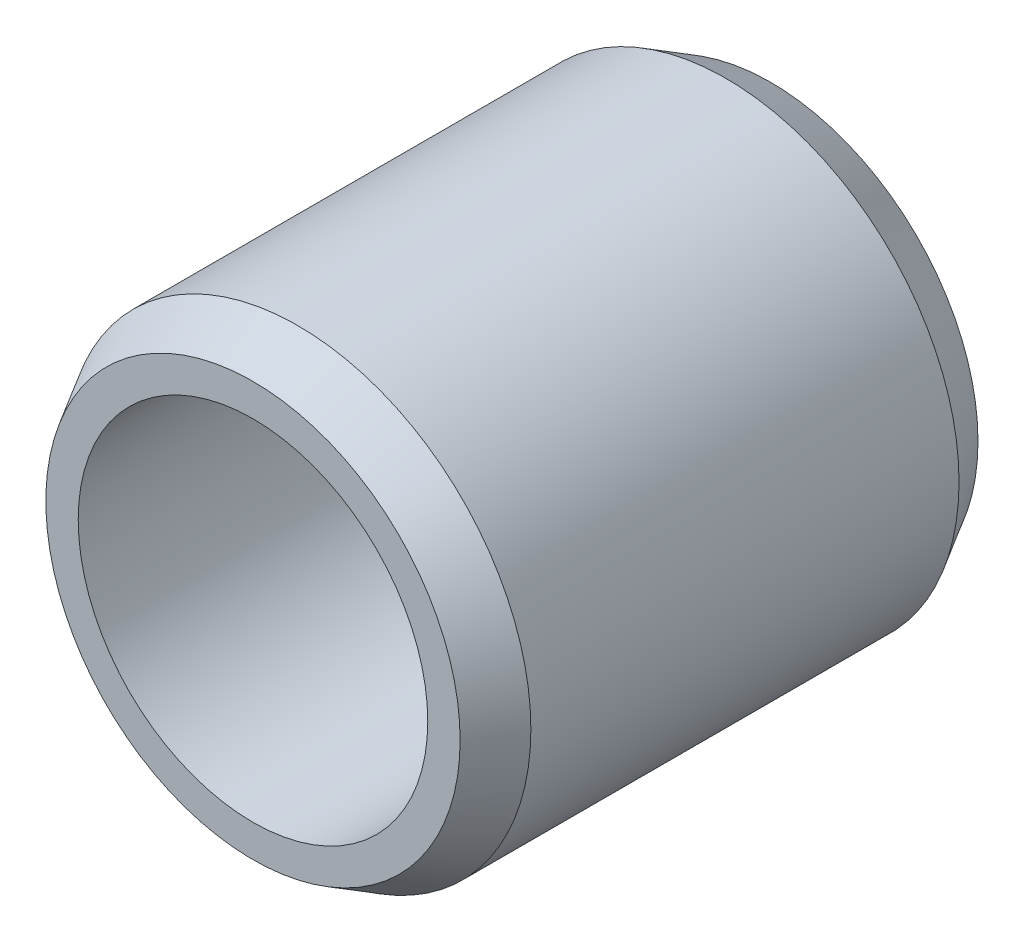
from build123d import *
from OCP.BRepFilletAPI import BRepFilletAPI_MakeChamfer

# Parameters (mm, degrees)
SKETCH1_R           = 4.5
SKETCH1_R_2         = 3.375
BOSS_EXTRUDE1_DEPTH = 10
CHAMFER1_SIZE       = 0.5
CHAMFER1_SIZE2      = 0.866025404


with BuildPart() as part:
    # Sketch1 → Boss-Extrude1 (new body)
    with BuildSketch(Plane.XY):
        Circle(SKETCH1_R)
        Circle(SKETCH1_R_2, mode=Mode.SUBTRACT)
    extrude(amount=BOSS_EXTRUDE1_DEPTH)

    # Chamfer1: one chamfer whose edges measure the first distance from different faces: ONE call of the kernel's chamfer builder (chamfer() names one face for all edges)
    chamfer1_edges_1 = [part.edges().sort_by_distance(p)[0] for p in [
        (-4.5, 0, 10),
    ]]
    chamfer1_side_1 = [part.faces().sort_by_distance(p)[0] for p in [
        (-4.372720779, 0, 10),
    ]]
    chamfer1_edges_2 = [part.edges().sort_by_distance(p)[0] for p in [
        (-4.5, 0, 0),
    ]]
    chamfer1_side_2 = [part.faces().sort_by_distance(p)[0] for p in [
        (-4.372720779, 0, 0),
    ]]
    chamfer1 = BRepFilletAPI_MakeChamfer(part.part.solid().wrapped)
    for e in chamfer1_edges_1:
        chamfer1.Add(CHAMFER1_SIZE, CHAMFER1_SIZE2, e.wrapped, chamfer1_side_1[0].wrapped)  # the first distance lies on this face
    for e in chamfer1_edges_2:
        chamfer1.Add(CHAMFER1_SIZE, CHAMFER1_SIZE2, e.wrapped, chamfer1_side_2[0].wrapped)  # the first distance lies on this face
    add(Compound.cast(chamfer1.Shape()), mode=Mode.REPLACE)


solid = part.part
